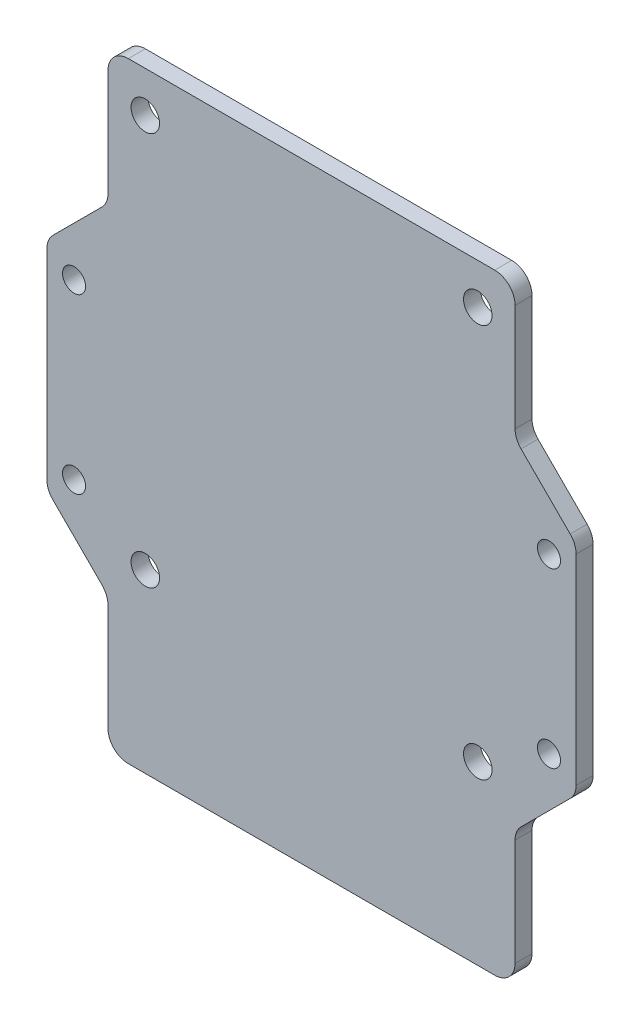
from build123d import *

# Parameters (mm, degrees)
BOSS_EXTRUDE1_DEPTH        = 1.25
FILLET1_R                  = 3
F_4_2_4_2_DIAMETER_HOLE1_D = 4.2
M3_CLEARANCE_HOLE1_D       = 3.4


with BuildPart() as part:
    # Sketch1 → Boss-Extrude1 (new, symmetric)
    with BuildSketch(Plane.XY):
        Polygon((-39, 16), (-39, -16), (-30, -25), (-30, -45), (30, -45), (30, -25), (39, -16), (39, 16), (30, 25), (30, 45), (-30, 45), (-30, 25), align=None)
    extrude(amount=BOSS_EXTRUDE1_DEPTH, both=True)

    # Fillet1
    fillet1_edges = [part.edges().sort_by_distance(p)[0] for p in [
        (30, 45, 0),
        (30, -45, 0),
        (-30, -45, 0),
        (-30, 45, 0),
        (30, 25, 0),
        (39, 16, 0),
        (39, -16, 0),
        (30, -25, 0),
        (-30, -25, 0),
        (-39, -16, 0),
        (-39, 16, 0),
        (-30, 25, 0),
    ]]
    fillet(fillet1_edges, radius=FILLET1_R)

    # Ø4.2 (4.2) Diameter Hole1 (through all)
    with Locations(Plane(origin=(0, 0, -1.25), x_dir=(-1, 0, 0), z_dir=(0, 0, -1))):
        with Locations((-24.5, -19), (24.5, -19), (24.5, 39), (-24.5, 39)):
            Hole(F_4_2_4_2_DIAMETER_HOLE1_D / 2)

    # M3 Clearance Hole1 (through all)
    with Locations(Plane(origin=(0, 0, -1.25), x_dir=(-1, 0, 0), z_dir=(0, 0, -1))):
        with Locations((-35, 12.75), (-35, -12.75), (35, -12.75), (35, 12.75)):
            Hole(M3_CLEARANCE_HOLE1_D / 2)


solid = part.part
